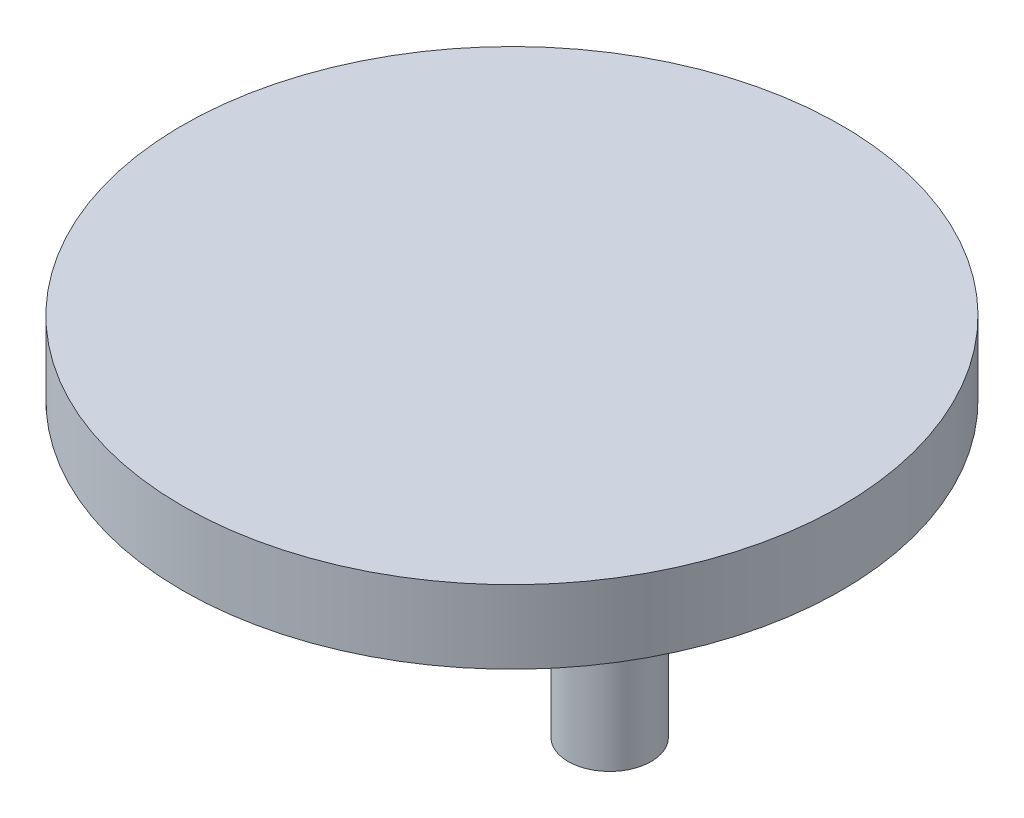
from build123d import *

# Parameters (mm, degrees)
SKETCH2_R           = 27
BOSS_EXTRUDE1_DEPTH = 6
SKETCH1_R           = 3.4
BOSS_EXTRUDE2_DEPTH = 9
CHAMFER1_SIZE       = 1


with BuildPart() as part:
    # Sketch2 → Boss-Extrude1 (new body)
    with BuildSketch(Plane(origin=(0, 0, 0), x_dir=(1, 0, 0), z_dir=(0, 1, 0))):
        Circle(SKETCH2_R)
    extrude(amount=BOSS_EXTRUDE1_DEPTH)

    # Sketch1 → Boss-Extrude2 (add)
    with BuildSketch(Plane(origin=(0, 0, 0), x_dir=(1, 0, 0), z_dir=(0, 1, 0))):
        with Locations((0, 21.875)):
            Circle(SKETCH1_R)
        with Locations((18.944305708, -10.9375)):
            Circle(SKETCH1_R)
        with Locations((-18.944305708, -10.9375)):
            Circle(SKETCH1_R)
    extrude(amount=-BOSS_EXTRUDE2_DEPTH)

    # Chamfer1
    chamfer1_edges = [part.edges().sort_by_distance(p)[0] for p in [
        (-22.344305708, 0, 10.9375),
        (-3.4, 0, -21.875),
        (15.544305708, 0, 10.9375),
    ]]
    chamfer(chamfer1_edges, length=CHAMFER1_SIZE)


solid = part.part
